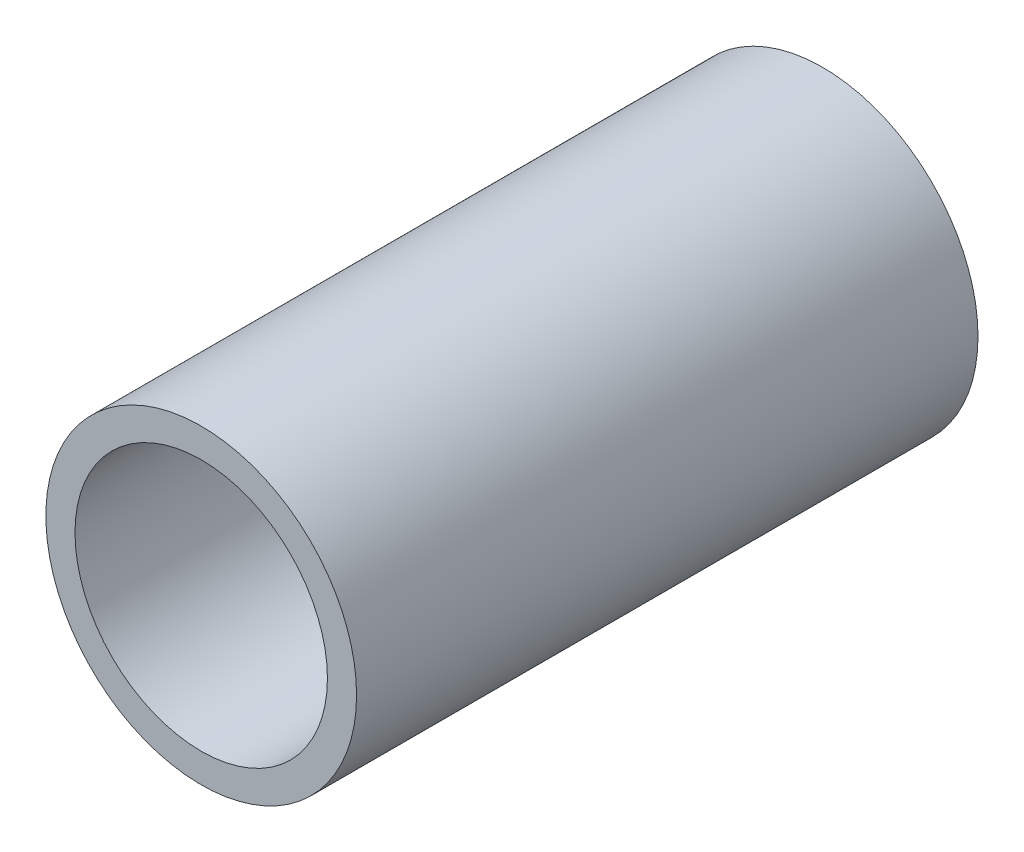
from build123d import *

# Parameters (mm, degrees)
SKETCH1_R           = 4
SKETCH1_R_2         = 3.25
BOSS_EXTRUDE1_DEPTH = 16


with BuildPart() as part:
    # Sketch1 → Boss-Extrude1 (new body)
    with BuildSketch(Plane.XY):
        Circle(SKETCH1_R)
        Circle(SKETCH1_R_2, mode=Mode.SUBTRACT)
    extrude(amount=BOSS_EXTRUDE1_DEPTH)


solid = part.part
